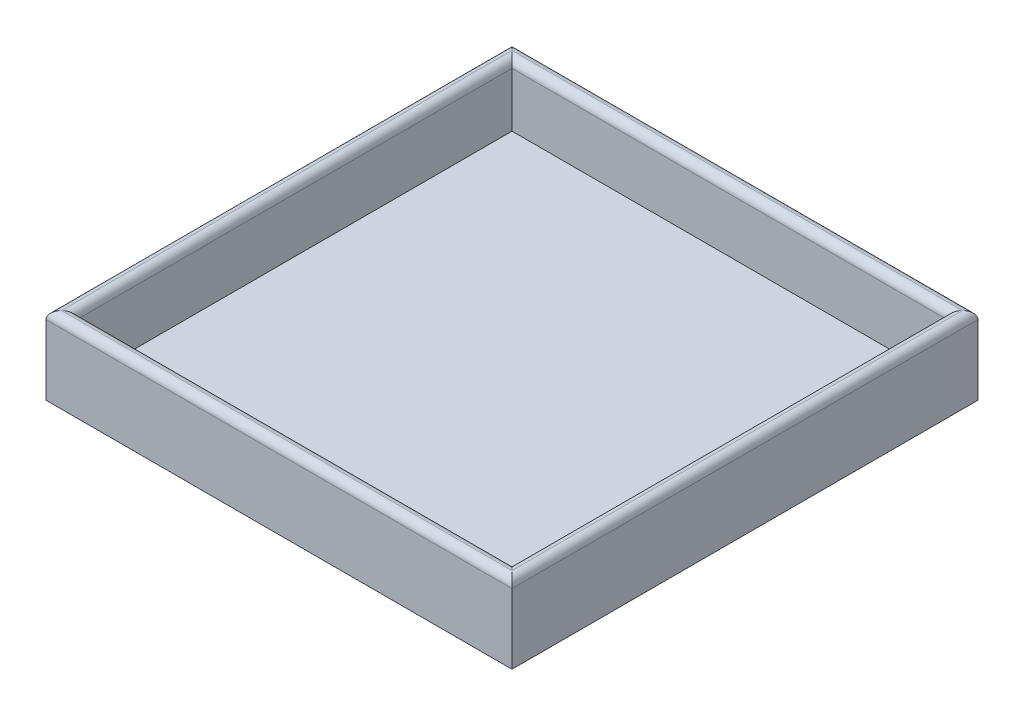
from build123d import *

# Parameters (mm, degrees)
SKETCH1_W           = 300
SKETCH1_H           = 300
BOSS_EXTRUDE1_DEPTH = 50
SKETCH2_W           = 280
SKETCH2_H           = 280
CUT_EXTRUDE1_DEPTH  = 40
FILLET1_R           = 5


with BuildPart() as part:
    # Sketch1 → Boss-Extrude1 (new body)
    with BuildSketch(Plane(origin=(0, 0, 0), x_dir=(1, 0, 0), z_dir=(0, 1, 0))):
        with Locations((150, 150)):
            Rectangle(SKETCH1_W, SKETCH1_H)
    extrude(amount=BOSS_EXTRUDE1_DEPTH)

    # Sketch2 → Cut-Extrude1 (cut)
    with BuildSketch(Plane(origin=(0, 50, 0), x_dir=(1, 0, 0), z_dir=(0, 1, 0))):
        with Locations((150, 150)):
            Rectangle(SKETCH2_W, SKETCH2_H)
    extrude(amount=-CUT_EXTRUDE1_DEPTH, mode=Mode.SUBTRACT)

    # Fillet1
    fillet1_edges = [part.edges().sort_by_distance(p)[0] for p in [
        (300, 50, -150),
        (150, 50, 0),
        (290, 50, -150),
        (150, 50, -290),
        (10, 50, -150),
        (150, 50, -10),
        (0, 50, -150),
        (150, 50, -300),
    ]]
    fillet(fillet1_edges, radius=FILLET1_R - 0.0001)  # a hair under: the kernel refuses the full size


solid = part.part
